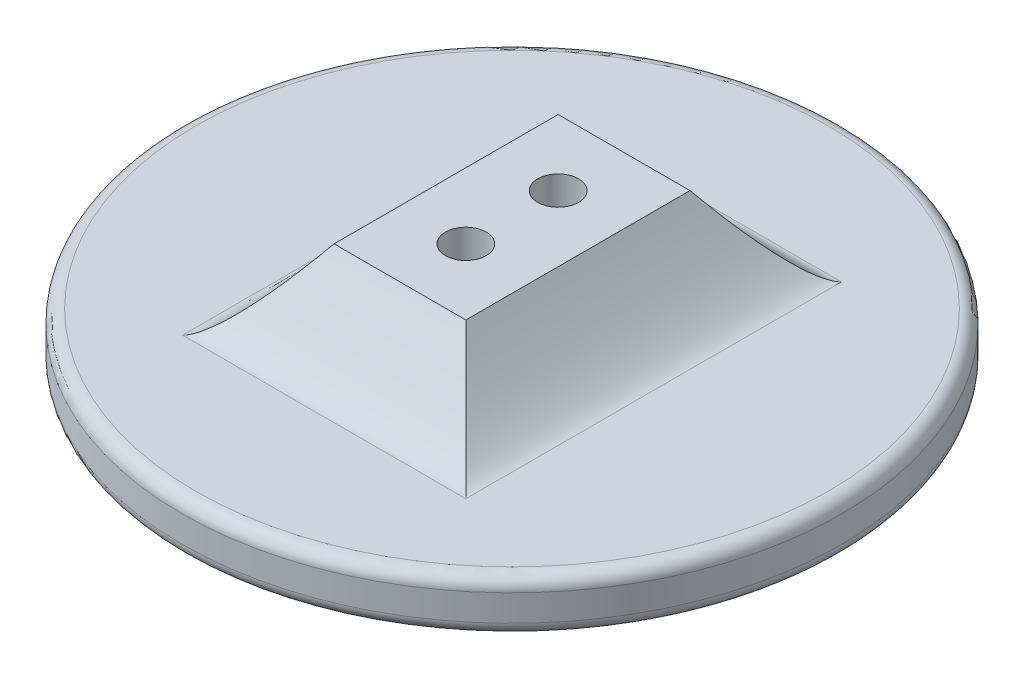
from build123d import *

# Parameters (mm, degrees)
SKETCH2_R           = 25
BOSS_EXTRUDE1_DEPTH = 4
SKETCH3_W           = 10
SKETCH3_H           = 17
BOSS_EXTRUDE2_DEPTH = 6
FILLET1_START       = -8.5
FILLET1_DEPTH       = 17
FILLET1_START_2     = -10.744562747
FILLET1_2_DEPTH     = 21.489125494
FILLET1_START_3     = -15
FILLET1_3_DEPTH     = 30
SKETCH4_R           = 1.55
CUT_EXTRUDE1_DEPTH  = 37.742346142
SKETCH5_R           = 2.9
CUT_EXTRUDE2_DEPTH  = 6.1
FILLET2_R           = 1


with BuildPart() as part:
    # Sketch2 → Boss-Extrude1 (new body)
    with BuildSketch(Plane(origin=(0, 0, 0), x_dir=(1, 0, 0), z_dir=(0, 1, 0))):
        with Locations(Location((0, 0, 0), (0, 0, 270))):
            Circle(SKETCH2_R)
    extrude(amount=BOSS_EXTRUDE1_DEPTH)

    # Sketch3 → Boss-Extrude2 (add)
    with BuildSketch(Plane(origin=(0, 4, 0), x_dir=(1, 0, 0), z_dir=(0, 1, 0))):
        Rectangle(SKETCH3_W, SKETCH3_H)
    extrude(amount=BOSS_EXTRUDE2_DEPTH)

    # Fillet1: read off the stored shape, not the designer's step
    # Fillet1 outline → Fillet1 (add)
    with BuildSketch(Plane.XY.offset(FILLET1_START)):
        with BuildLine():
            Line((-10.744562647, 4), (-5, 4))
            Line((-5, 4), (-5, 10))
            add(Edge.make_bspline(
                [(-5, 10), (-9.177863743, 4), (-10.744562647, 4)],
                knots=[0, 0, 0, 1, 1, 1], degree=2, weights=[1, 0.88640526, 1]))
        make_face()
        with BuildLine():
            add(Edge.make_bspline(
                [(5, 10), (9.177863743, 4), (10.744562647, 4)],
                knots=[0, 0, 0, 1, 1, 1], degree=2, weights=[1, 0.88640526, 1]))
            Line((5, 10), (5, 4))
            Line((5, 4), (10.744562647, 4))
        make_face()
    extrude(amount=FILLET1_DEPTH)

    # Fillet1 2 outline → Fillet1 2 (add)
    with BuildSketch(Plane.YZ.offset(FILLET1_START_2)):
        with BuildLine():
            Line((4, 14.244562647), (4, 8.5))
            Line((4, 8.5), (10, 8.5))
            add(Edge.make_bspline(
                [(10, 8.5), (4, 12.677863743), (4, 14.244562647)],
                knots=[0, 0, 0, 1, 1, 1], degree=2, weights=[1, 0.88640526, 1]))
        make_face()
        with BuildLine():
            add(Edge.make_bspline(
                [(10, -8.5), (4, -12.677863743), (4, -14.244562647)],
                knots=[0, 0, 0, 1, 1, 1], degree=2, weights=[1, 0.88640526, 1]))
            Line((10, -8.5), (4, -8.5))
            Line((4, -8.5), (4, -14.244562647))
        make_face()
    extrude(amount=FILLET1_2_DEPTH)

    # Fillet1 3 outline → Fillet1 3 (cut)
    with BuildSketch(Plane.XY.offset(FILLET1_START_3)):
        with BuildLine():
            add(Edge.make_bspline(
                [(5, 10), (9.177863743, 4), (10.744562647, 4)],
                knots=[0, 0, 0, 1, 1, 1], degree=2, weights=[1, 0.88640526, 1]))
            Line((10.744562647, 4), (10.744562747, 10))
            Line((10.744562747, 10), (5, 10))
        make_face()
        with BuildLine():
            add(Edge.make_bspline(
                [(-5, 10), (-9.177863743, 4), (-10.744562647, 4)],
                knots=[0, 0, 0, 1, 1, 1], degree=2, weights=[1, 0.88640526, 1]))
            Line((-5, 10), (-10.744562747, 10))
            Line((-10.744562747, 10), (-10.744562647, 4))
        make_face()
    extrude(amount=FILLET1_3_DEPTH, mode=Mode.SUBTRACT)

    # Sketch4 → Cut-Extrude1 (cut, through all)
    with BuildSketch(Plane(origin=(0, 10, 0), x_dir=(1, 0, 0), z_dir=(0, 1, 0))):
        with Locations(Location((0, 3.5, 0), (0, 0, 270))):
            Circle(SKETCH4_R)
        with Locations(Location((0, -3.5, 0), (0, 0, 90))):
            Circle(SKETCH4_R)
    extrude(amount=-CUT_EXTRUDE1_DEPTH, mode=Mode.SUBTRACT)

    # Sketch5 → Cut-Extrude2 (cut)
    with BuildSketch(Plane.XZ):
        with Locations(Location((0, 3.5, 0), (0, 0, 270))):
            Circle(SKETCH5_R)
        with Locations(Location((0, -3.5, 0), (0, 0, 90))):
            Circle(SKETCH5_R)
    extrude(amount=-CUT_EXTRUDE2_DEPTH, mode=Mode.SUBTRACT)

    # Fillet2
    fillet2_edges = [part.edges().sort_by_distance(p)[0] for p in [
        (0, 0, -25),
        (0, 4, -25),
    ]]
    fillet(fillet2_edges, radius=FILLET2_R)


solid = part.part
